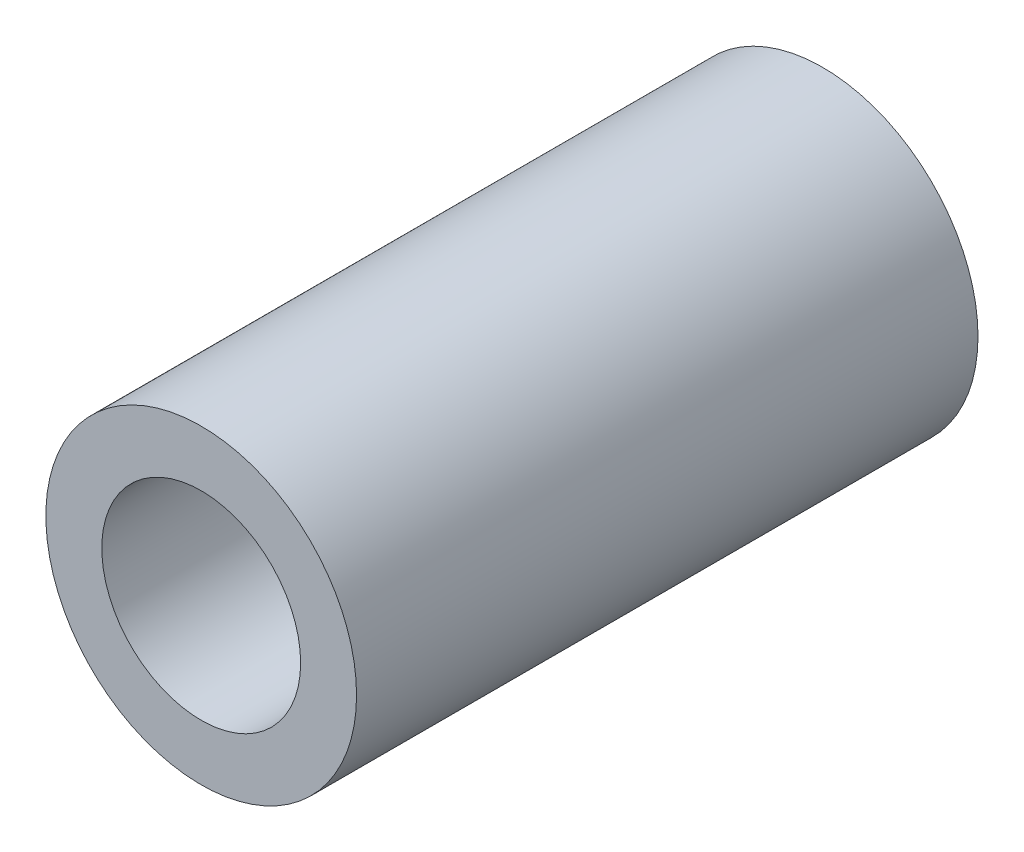
from build123d import *

# Parameters (mm, degrees)
SKETCH1_R           = 2.5
SKETCH1_R_2         = 1.6
BOSS_EXTRUDE1_DEPTH = 5


with BuildPart() as part:
    # Sketch1 → Boss-Extrude1 (new, symmetric)
    with BuildSketch(Plane.XY):
        Circle(SKETCH1_R)
        Circle(SKETCH1_R_2, mode=Mode.SUBTRACT)
    extrude(amount=BOSS_EXTRUDE1_DEPTH, both=True)


solid = part.part
